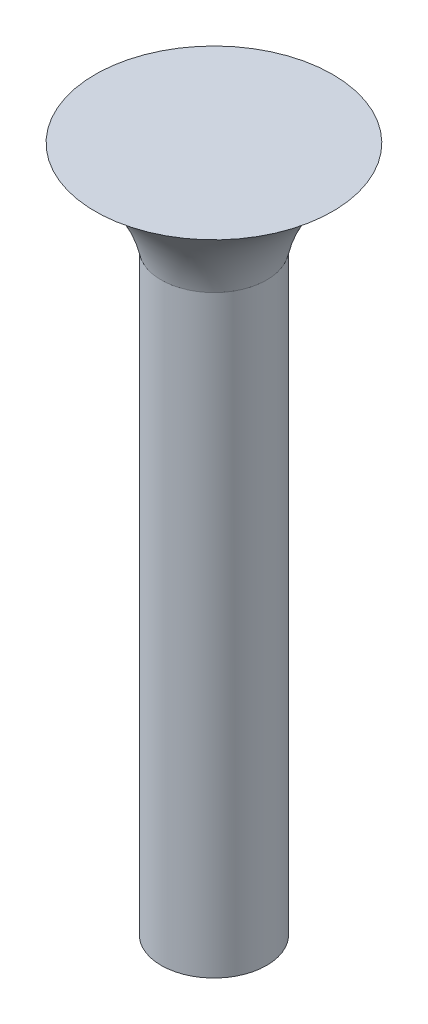
from build123d import *

# Parameters (mm, degrees)
SKETCH1_R           = 10.16
BOSS_EXTRUDE1_DEPTH = 132.08


with BuildPart() as part:
    # Sketch1 → Boss-Extrude1 (new body)
    with BuildSketch(Plane(origin=(0, 0, 0), x_dir=(1, 0, 0), z_dir=(0, 1, 0))):
        Circle(SKETCH1_R)
    extrude(amount=BOSS_EXTRUDE1_DEPTH)

    # Sketch2 → Revolve1 (revolve)
    with BuildSketch(Plane.XY):
        with BuildLine():
            Line((10.16, 132.08), (10.16, 114.3))
            ThreePointArc((10.16, 114.3), (14.631236278, 124.531974087), (22.86, 132.08))
            Line((22.86, 132.08), (10.16, 132.08))
        make_face()
    revolve(axis=Axis((0, 0, 0), (0, 1, 0)))


solid = part.part
